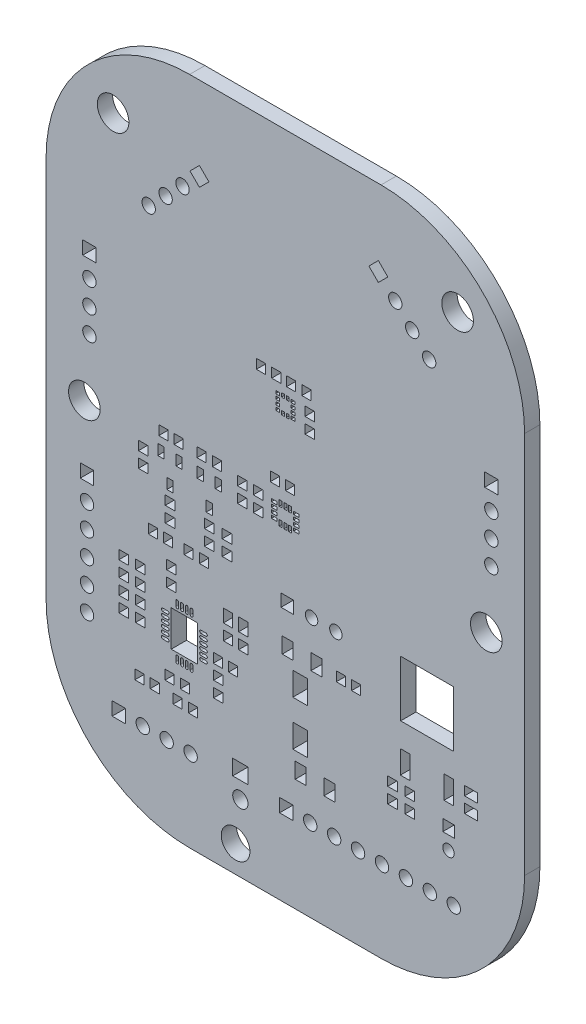
from build123d import *

# Parameters (mm, degrees)
MODEL_W            = 1.4
MODEL_H            = 1.4
MODEL_R            = 0.7
MODEL_W_2          = 0.95
MODEL_H_2          = 1
MODEL_R_2          = 1.5
MODEL_R_3          = 0.8
MODEL_W_3          = 1
MODEL_H_3          = 0.95
MODEL_W_4          = 1.6
MODEL_H_4          = 1.6
MODEL_W_5          = 0.65
MODEL_H_5          = 1.1
MODEL_W_6          = 2.75
MODEL_H_6          = 3.75
MODEL_H_7          = 1.35
MODEL_W_7          = 0.6
MODEL_H_8          = 0.3
MODEL_W_8          = 0.3
MODEL_H_9          = 0.6
MODEL_W_9          = 1.15
MODEL_H_10         = 1.65
MODEL_W_10         = 1.55
MODEL_H_11         = 2.45
MODEL_R_4          = 0.6
MODEL_W_11         = 1.2
MODEL_H_12         = 1.2
MODEL_W_12         = 1.3
MODEL_H_13         = 1.3
MODEL_R_5          = 0.65
MODEL_H_14         = 2.4
MODEL_W_13         = 5.5
MODEL_H_15         = 5.85
MODEL_W_14         = 1.35
MODEL_R_6          = 1.651
MODEL_W_15         = 0.4
MODEL_H_16         = 0.4
BOSS_EXTRU_1_DEPTH = 1.6


with BuildPart() as part:
    # Model → Boss.-Extru.1 (new body)
    with BuildSketch(Plane.XY):
        with BuildLine():
            ThreePointArc((0, 15), (4.393395, 4.393395), (15, 0))
            Line((15, 0), (35, 0))
            ThreePointArc((35, 0), (45.606605, 4.393395), (50, 15))
            Line((50, 15), (50, 55))
            ThreePointArc((50, 55), (45.606605, 65.606605), (35, 70))
            Line((35, 70), (15, 70))
            ThreePointArc((15, 70), (4.393395, 65.606605), (0, 55))
            Line((0, 55), (0, 15))
        make_face()
        with Locations((7.6, 8.575)):
            Rectangle(MODEL_W, MODEL_H, mode=Mode.SUBTRACT)
        with Locations((10.1, 8.575)):
            Circle(MODEL_R, mode=Mode.SUBTRACT)
        with Locations((4.275, 15.95)):
            Circle(MODEL_R, mode=Mode.SUBTRACT)
        with Locations((9.75, 12.85)):
            Rectangle(MODEL_W_2, MODEL_H_2, mode=Mode.SUBTRACT)
        with Locations((11.35, 12.85)):
            Rectangle(MODEL_W_2, MODEL_H_2, mode=Mode.SUBTRACT)
        with Locations((12.6, 8.575)):
            Circle(MODEL_R, mode=Mode.SUBTRACT)
        with Locations((15.1, 8.575)):
            Circle(MODEL_R, mode=Mode.SUBTRACT)
        with Locations((19.8, 2.8)):
            Circle(MODEL_R_2, mode=Mode.SUBTRACT)
        with Locations((20.3, 7.03)):
            Circle(MODEL_R_3, mode=Mode.SUBTRACT)
        with Locations((13.75, 12.65)):
            Rectangle(MODEL_W_2, MODEL_H_2, mode=Mode.SUBTRACT)
        with Locations((15.35, 12.65)):
            Rectangle(MODEL_W_2, MODEL_H_2, mode=Mode.SUBTRACT)
        with Locations((12.9, 14.4)):
            Rectangle(MODEL_W_2, MODEL_H_2, mode=Mode.SUBTRACT)
        with Locations((14.5, 14.4)):
            Rectangle(MODEL_W_2, MODEL_H_2, mode=Mode.SUBTRACT)
        with BuildLine():
            ThreePointArc((13.85, 16.15), (13.7, 16), (13.55, 16.15))
            Line((13.55, 16.15), (13.55, 16.65))
            ThreePointArc((13.55, 16.65), (13.7, 16.8), (13.85, 16.65))
            Line((13.85, 16.65), (13.85, 16.15))
        make_face(mode=Mode.SUBTRACT)
        with BuildLine():
            ThreePointArc((14.35, 16.15), (14.2, 16), (14.05, 16.15))
            Line((14.05, 16.15), (14.05, 16.65))
            ThreePointArc((14.05, 16.65), (14.2, 16.8), (14.35, 16.65))
            Line((14.35, 16.65), (14.35, 16.15))
        make_face(mode=Mode.SUBTRACT)
        with BuildLine():
            ThreePointArc((14.85, 16.15), (14.7, 16), (14.55, 16.15))
            Line((14.55, 16.15), (14.55, 16.65))
            ThreePointArc((14.55, 16.65), (14.7, 16.8), (14.85, 16.65))
            Line((14.85, 16.65), (14.85, 16.15))
        make_face(mode=Mode.SUBTRACT)
        with BuildLine():
            ThreePointArc((15.35, 16.15), (15.2, 16), (15.05, 16.15))
            Line((15.05, 16.15), (15.05, 16.65))
            ThreePointArc((15.05, 16.65), (15.2, 16.8), (15.35, 16.65))
            Line((15.35, 16.65), (15.35, 16.15))
        make_face(mode=Mode.SUBTRACT)
        with Locations((18, 15.3)):
            Rectangle(MODEL_W_3, MODEL_H_3, mode=Mode.SUBTRACT)
        with Locations((18, 16.9)):
            Rectangle(MODEL_W_3, MODEL_H_3, mode=Mode.SUBTRACT)
        with Locations((20.3, 9.57)):
            Rectangle(MODEL_W_4, MODEL_H_4, mode=Mode.SUBTRACT)
        with Locations((4.275, 18.45)):
            Circle(MODEL_R, mode=Mode.SUBTRACT)
        with Locations((4.275, 20.95)):
            Circle(MODEL_R, mode=Mode.SUBTRACT)
        with Locations((4.275, 23.45)):
            Circle(MODEL_R, mode=Mode.SUBTRACT)
        with Locations((4.275, 25.95)):
            Circle(MODEL_R, mode=Mode.SUBTRACT)
        with Locations((8.1, 18.05)):
            Rectangle(MODEL_W_3, MODEL_H_3, mode=Mode.SUBTRACT)
        with Locations((8.1, 19.65)):
            Rectangle(MODEL_W_3, MODEL_H_3, mode=Mode.SUBTRACT)
        with Locations((8.1, 21.25)):
            Rectangle(MODEL_W_3, MODEL_H_3, mode=Mode.SUBTRACT)
        with Locations((9.85, 18.05)):
            Rectangle(MODEL_W_3, MODEL_H_3, mode=Mode.SUBTRACT)
        with Locations((9.85, 19.65)):
            Rectangle(MODEL_W_3, MODEL_H_3, mode=Mode.SUBTRACT)
        with BuildLine():
            ThreePointArc((12.2, 17.5), (12.05, 17.65), (12.2, 17.8))
            Line((12.2, 17.8), (12.7, 17.8))
            ThreePointArc((12.7, 17.8), (12.85, 17.65), (12.7, 17.5))
            Line((12.7, 17.5), (12.2, 17.5))
        make_face(mode=Mode.SUBTRACT)
        with BuildLine():
            ThreePointArc((12.2, 18), (12.05, 18.15), (12.2, 18.3))
            Line((12.2, 18.3), (12.7, 18.3))
            ThreePointArc((12.7, 18.3), (12.85, 18.15), (12.7, 18))
            Line((12.7, 18), (12.2, 18))
        make_face(mode=Mode.SUBTRACT)
        with BuildLine():
            ThreePointArc((12.2, 18.5), (12.05, 18.65), (12.2, 18.8))
            Line((12.2, 18.8), (12.7, 18.8))
            ThreePointArc((12.7, 18.8), (12.85, 18.65), (12.7, 18.5))
            Line((12.7, 18.5), (12.2, 18.5))
        make_face(mode=Mode.SUBTRACT)
        with BuildLine():
            ThreePointArc((12.2, 19), (12.05, 19.15), (12.2, 19.3))
            Line((12.2, 19.3), (12.7, 19.3))
            ThreePointArc((12.7, 19.3), (12.85, 19.15), (12.7, 19))
            Line((12.7, 19), (12.2, 19))
        make_face(mode=Mode.SUBTRACT)
        with BuildLine():
            ThreePointArc((12.2, 19.5), (12.05, 19.65), (12.2, 19.8))
            Line((12.2, 19.8), (12.7, 19.8))
            ThreePointArc((12.7, 19.8), (12.85, 19.65), (12.7, 19.5))
            Line((12.7, 19.5), (12.2, 19.5))
        make_face(mode=Mode.SUBTRACT)
        with Locations((9.85, 21.25)):
            Rectangle(MODEL_W_3, MODEL_H_3, mode=Mode.SUBTRACT)
        with BuildLine():
            ThreePointArc((12.2, 20), (12.05, 20.15), (12.2, 20.3))
            Line((12.2, 20.3), (12.7, 20.3))
            ThreePointArc((12.7, 20.3), (12.85, 20.15), (12.7, 20))
            Line((12.7, 20), (12.2, 20))
        make_face(mode=Mode.SUBTRACT)
        with Locations((8.1, 22.85)):
            Rectangle(MODEL_W_3, MODEL_H_3, mode=Mode.SUBTRACT)
        with Locations((9.85, 22.85)):
            Rectangle(MODEL_W_3, MODEL_H_3, mode=Mode.SUBTRACT)
        with Locations((4.275, 28.45)):
            Rectangle(MODEL_W, MODEL_H, mode=Mode.SUBTRACT)
        with Locations((11.15, 26.75)):
            Rectangle(MODEL_W_2, MODEL_H_2, mode=Mode.SUBTRACT)
        with Locations((10.15, 32.15)):
            Rectangle(MODEL_W_3, MODEL_H_3, mode=Mode.SUBTRACT)
        with Locations((10.15, 33.75)):
            Rectangle(MODEL_W_3, MODEL_H_3, mode=Mode.SUBTRACT)
        with Locations((12, 34.4)):
            Rectangle(MODEL_W_5, MODEL_H_5, mode=Mode.SUBTRACT)
        with Locations((14.45, 18.9)):
            Rectangle(MODEL_W_6, MODEL_H_6, mode=Mode.SUBTRACT)
        with BuildLine():
            ThreePointArc((13.85, 21.15), (13.7, 21), (13.55, 21.15))
            Line((13.55, 21.15), (13.55, 21.65))
            ThreePointArc((13.55, 21.65), (13.7, 21.8), (13.85, 21.65))
            Line((13.85, 21.65), (13.85, 21.15))
        make_face(mode=Mode.SUBTRACT)
        with BuildLine():
            ThreePointArc((14.35, 21.15), (14.2, 21), (14.05, 21.15))
            Line((14.05, 21.15), (14.05, 21.65))
            ThreePointArc((14.05, 21.65), (14.2, 21.8), (14.35, 21.65))
            Line((14.35, 21.65), (14.35, 21.15))
        make_face(mode=Mode.SUBTRACT)
        with BuildLine():
            ThreePointArc((14.85, 21.15), (14.7, 21), (14.55, 21.15))
            Line((14.55, 21.15), (14.55, 21.65))
            ThreePointArc((14.55, 21.65), (14.7, 21.8), (14.85, 21.65))
            Line((14.85, 21.65), (14.85, 21.15))
        make_face(mode=Mode.SUBTRACT)
        with BuildLine():
            ThreePointArc((15.35, 21.15), (15.2, 21), (15.05, 21.15))
            Line((15.05, 21.15), (15.05, 21.65))
            ThreePointArc((15.05, 21.65), (15.2, 21.8), (15.35, 21.65))
            Line((15.35, 21.65), (15.35, 21.15))
        make_face(mode=Mode.SUBTRACT)
        with BuildLine():
            ThreePointArc((16.2, 17.5), (16.05, 17.65), (16.2, 17.8))
            Line((16.2, 17.8), (16.7, 17.8))
            ThreePointArc((16.7, 17.8), (16.85, 17.65), (16.7, 17.5))
            Line((16.7, 17.5), (16.2, 17.5))
        make_face(mode=Mode.SUBTRACT)
        with BuildLine():
            ThreePointArc((16.2, 18), (16.05, 18.15), (16.2, 18.3))
            Line((16.2, 18.3), (16.7, 18.3))
            ThreePointArc((16.7, 18.3), (16.85, 18.15), (16.7, 18))
            Line((16.7, 18), (16.2, 18))
        make_face(mode=Mode.SUBTRACT)
        with BuildLine():
            ThreePointArc((16.2, 18.5), (16.05, 18.65), (16.2, 18.8))
            Line((16.2, 18.8), (16.7, 18.8))
            ThreePointArc((16.7, 18.8), (16.85, 18.65), (16.7, 18.5))
            Line((16.7, 18.5), (16.2, 18.5))
        make_face(mode=Mode.SUBTRACT)
        with BuildLine():
            ThreePointArc((16.2, 19), (16.05, 19.15), (16.2, 19.3))
            Line((16.2, 19.3), (16.7, 19.3))
            ThreePointArc((16.7, 19.3), (16.85, 19.15), (16.7, 19))
            Line((16.7, 19), (16.2, 19))
        make_face(mode=Mode.SUBTRACT)
        with BuildLine():
            ThreePointArc((16.2, 19.5), (16.05, 19.65), (16.2, 19.8))
            Line((16.2, 19.8), (16.7, 19.8))
            ThreePointArc((16.7, 19.8), (16.85, 19.65), (16.7, 19.5))
            Line((16.7, 19.5), (16.2, 19.5))
        make_face(mode=Mode.SUBTRACT)
        with Locations((17.95, 18.45)):
            Rectangle(MODEL_W_2, MODEL_H_2, mode=Mode.SUBTRACT)
        with BuildLine():
            ThreePointArc((16.2, 20), (16.05, 20.15), (16.2, 20.3))
            Line((16.2, 20.3), (16.7, 20.3))
            ThreePointArc((16.7, 20.3), (16.85, 20.15), (16.7, 20))
            Line((16.7, 20), (16.2, 20))
        make_face(mode=Mode.SUBTRACT)
        with Locations((13.1, 22.85)):
            Rectangle(MODEL_W_3, MODEL_H_3, mode=Mode.SUBTRACT)
        with Locations((13.1, 24.45)):
            Rectangle(MODEL_W_3, MODEL_H_3, mode=Mode.SUBTRACT)
        with Locations((19.55, 18.45)):
            Rectangle(MODEL_W_2, MODEL_H_2, mode=Mode.SUBTRACT)
        with Locations((19, 21)):
            Rectangle(MODEL_W_2, MODEL_H_2, mode=Mode.SUBTRACT)
        with Locations((20.6, 21)):
            Rectangle(MODEL_W_2, MODEL_H_2, mode=Mode.SUBTRACT)
        with Locations((19, 22.8)):
            Rectangle(MODEL_W_2, MODEL_H_7, mode=Mode.SUBTRACT)
        with Locations((20.6, 22.8)):
            Rectangle(MODEL_W_2, MODEL_H_7, mode=Mode.SUBTRACT)
        with Locations((12.75, 26.75)):
            Rectangle(MODEL_W_2, MODEL_H_2, mode=Mode.SUBTRACT)
        with Locations((14.9, 26.75)):
            Rectangle(MODEL_W_2, MODEL_H_2, mode=Mode.SUBTRACT)
        with Locations((12.95, 28.6)):
            Rectangle(MODEL_W_3, MODEL_H_3, mode=Mode.SUBTRACT)
        with Locations((12.95, 30.2)):
            Rectangle(MODEL_W_3, MODEL_H_3, mode=Mode.SUBTRACT)
        with Locations((16.5, 26.75)):
            Rectangle(MODEL_W_2, MODEL_H_2, mode=Mode.SUBTRACT)
        with Locations((17.05, 28.55)):
            Rectangle(MODEL_W_3, MODEL_H_3, mode=Mode.SUBTRACT)
        with Locations((17.05, 30.15)):
            Rectangle(MODEL_W_3, MODEL_H_3, mode=Mode.SUBTRACT)
        with Locations((12.95, 31.8)):
            Rectangle(MODEL_W_5, MODEL_H_5, mode=Mode.SUBTRACT)
        with Locations((13.9, 34.4)):
            Rectangle(MODEL_W_5, MODEL_H_5, mode=Mode.SUBTRACT)
        with Locations((17.05, 31.8)):
            Rectangle(MODEL_W_5, MODEL_H_5, mode=Mode.SUBTRACT)
        with Locations((16.1, 34.4)):
            Rectangle(MODEL_W_5, MODEL_H_5, mode=Mode.SUBTRACT)
        with Locations((18, 34.4)):
            Rectangle(MODEL_W_5, MODEL_H_5, mode=Mode.SUBTRACT)
        with Locations((18.9, 28.55)):
            Rectangle(MODEL_W_3, MODEL_H_3, mode=Mode.SUBTRACT)
        with Locations((18.9, 30.15)):
            Rectangle(MODEL_W_3, MODEL_H_3, mode=Mode.SUBTRACT)
        with Locations((20.5, 34.15)):
            Rectangle(MODEL_W_3, MODEL_H_3, mode=Mode.SUBTRACT)
        with Locations((22.15, 34.15)):
            Rectangle(MODEL_W_3, MODEL_H_3, mode=Mode.SUBTRACT)
        with Locations((23.85, 34.25)):
            Rectangle(MODEL_W_7, MODEL_H_8, mode=Mode.SUBTRACT)
        with Locations((23.85, 34.75)):
            Rectangle(MODEL_W_7, MODEL_H_8, mode=Mode.SUBTRACT)
        with Locations((24.5, 34.1)):
            Rectangle(MODEL_W_8, MODEL_H_9, mode=Mode.SUBTRACT)
        with Locations((25.1, 8.575)):
            Rectangle(MODEL_W, MODEL_H, mode=Mode.SUBTRACT)
        with Locations((27.6, 8.575)):
            Circle(MODEL_R, mode=Mode.SUBTRACT)
        with Locations((30.1, 8.575)):
            Circle(MODEL_R, mode=Mode.SUBTRACT)
        with Locations((32.6, 8.575)):
            Circle(MODEL_R, mode=Mode.SUBTRACT)
        with Locations((35.1, 8.575)):
            Circle(MODEL_R, mode=Mode.SUBTRACT)
        with Locations((26.6, 12.55)):
            Rectangle(MODEL_W_9, MODEL_H_10, mode=Mode.SUBTRACT)
        with Locations((29.6, 12.55)):
            Rectangle(MODEL_W_9, MODEL_H_10, mode=Mode.SUBTRACT)
        with Locations((26.55, 15.55)):
            Rectangle(MODEL_W_10, MODEL_H_11, mode=Mode.SUBTRACT)
        with Locations((36.2, 14.8)):
            Rectangle(MODEL_W_3, MODEL_H_3, mode=Mode.SUBTRACT)
        with Locations((36.2, 16.4)):
            Rectangle(MODEL_W_3, MODEL_H_3, mode=Mode.SUBTRACT)
        with Locations((37.6, 8.575)):
            Circle(MODEL_R, mode=Mode.SUBTRACT)
        with Locations((40.1, 8.575)):
            Circle(MODEL_R, mode=Mode.SUBTRACT)
        with Locations((42.6, 8.575)):
            Circle(MODEL_R, mode=Mode.SUBTRACT)
        with Locations((38, 14.8)):
            Rectangle(MODEL_W_3, MODEL_H_3, mode=Mode.SUBTRACT)
        with Locations((38, 16.4)):
            Rectangle(MODEL_W_3, MODEL_H_3, mode=Mode.SUBTRACT)
        with Locations((42.05, 13.3)):
            Circle(MODEL_R_4, mode=Mode.SUBTRACT)
        with Locations((42.05, 15.3)):
            Rectangle(MODEL_W_11, MODEL_H_12, mode=Mode.SUBTRACT)
        with Locations((26.55, 20.25)):
            Rectangle(MODEL_W_10, MODEL_H_11, mode=Mode.SUBTRACT)
        with Locations((25.25, 23.2)):
            Rectangle(MODEL_W_9, MODEL_H_10, mode=Mode.SUBTRACT)
        with Locations((28.25, 23.2)):
            Rectangle(MODEL_W_9, MODEL_H_10, mode=Mode.SUBTRACT)
        with Locations((30.8, 23.2)):
            Rectangle(MODEL_W_2, MODEL_H_2, mode=Mode.SUBTRACT)
        with Locations((32.4, 23.2)):
            Rectangle(MODEL_W_2, MODEL_H_2, mode=Mode.SUBTRACT)
        with Locations((25.2, 27.2)):
            Rectangle(MODEL_W_12, MODEL_H_13, mode=Mode.SUBTRACT)
        with Locations((27.74, 27.2)):
            Circle(MODEL_R_5, mode=Mode.SUBTRACT)
        with Locations((30.28, 27.2)):
            Circle(MODEL_R_5, mode=Mode.SUBTRACT)
        with Locations((25, 34.1)):
            Rectangle(MODEL_W_8, MODEL_H_9, mode=Mode.SUBTRACT)
        with Locations((25.5, 34.1)):
            Rectangle(MODEL_W_8, MODEL_H_9, mode=Mode.SUBTRACT)
        with Locations((26.15, 34.25)):
            Rectangle(MODEL_W_7, MODEL_H_8, mode=Mode.SUBTRACT)
        with Locations((26.15, 34.75)):
            Rectangle(MODEL_W_7, MODEL_H_8, mode=Mode.SUBTRACT)
        with Locations((37.52, 18.8)):
            Rectangle(MODEL_W_3, MODEL_H_14, mode=Mode.SUBTRACT)
        with Locations((42.08, 18.8)):
            Rectangle(MODEL_W_3, MODEL_H_14, mode=Mode.SUBTRACT)
        with Locations((39.8, 25.45)):
            Rectangle(MODEL_W_13, MODEL_H_15, mode=Mode.SUBTRACT)
        with Locations((44.4, 17.95)):
            Rectangle(MODEL_W_14, MODEL_H_3, mode=Mode.SUBTRACT)
        with Locations((44.4, 19.55)):
            Rectangle(MODEL_W_14, MODEL_H_3, mode=Mode.SUBTRACT)
        with Locations((4, 35)):
            Circle(MODEL_R_6, mode=Mode.SUBTRACT)
        with Locations((4.525, 41.25)):
            Circle(MODEL_R, mode=Mode.SUBTRACT)
        with Locations((4.525, 43.75)):
            Circle(MODEL_R, mode=Mode.SUBTRACT)
        with Locations((12.25, 36.2)):
            Rectangle(MODEL_W_2, MODEL_H_2, mode=Mode.SUBTRACT)
        with Locations((4.525, 46.25)):
            Circle(MODEL_R, mode=Mode.SUBTRACT)
        with Locations((4.525, 48.75)):
            Rectangle(MODEL_W, MODEL_H, mode=Mode.SUBTRACT)
        with Locations((13.85, 36.2)):
            Rectangle(MODEL_W_2, MODEL_H_2, mode=Mode.SUBTRACT)
        with Locations((16.25, 36.2)):
            Rectangle(MODEL_W_2, MODEL_H_2, mode=Mode.SUBTRACT)
        with Locations((17.85, 36.2)):
            Rectangle(MODEL_W_2, MODEL_H_2, mode=Mode.SUBTRACT)
        with Locations((20.5, 35.75)):
            Rectangle(MODEL_W_3, MODEL_H_3, mode=Mode.SUBTRACT)
        with Locations((22.15, 35.75)):
            Rectangle(MODEL_W_3, MODEL_H_3, mode=Mode.SUBTRACT)
        with Locations((23.85, 35.25)):
            Rectangle(MODEL_W_7, MODEL_H_8, mode=Mode.SUBTRACT)
        with Locations((23.85, 35.75)):
            Rectangle(MODEL_W_7, MODEL_H_8, mode=Mode.SUBTRACT)
        with Locations((24.5, 35.9)):
            Rectangle(MODEL_W_8, MODEL_H_9, mode=Mode.SUBTRACT)
        with Locations((23.9, 37.85)):
            Rectangle(MODEL_W_2, MODEL_H_2, mode=Mode.SUBTRACT)
        with Locations((24.2, 44.25)):
            Rectangle(MODEL_W_15, MODEL_H_8, mode=Mode.SUBTRACT)
        with Locations((24.2, 44.75)):
            Rectangle(MODEL_W_15, MODEL_H_8, mode=Mode.SUBTRACT)
        with Locations((24.75, 44.2)):
            Rectangle(MODEL_W_8, MODEL_H_16, mode=Mode.SUBTRACT)
        with Locations((24.2, 45.25)):
            Rectangle(MODEL_W_15, MODEL_H_8, mode=Mode.SUBTRACT)
        with Locations((24.2, 45.75)):
            Rectangle(MODEL_W_15, MODEL_H_8, mode=Mode.SUBTRACT)
        with Locations((24.75, 45.8)):
            Rectangle(MODEL_W_8, MODEL_H_16, mode=Mode.SUBTRACT)
        with Locations((22.45, 47.3)):
            Rectangle(MODEL_W_2, MODEL_H_2, mode=Mode.SUBTRACT)
        with Locations((24.05, 47.3)):
            Rectangle(MODEL_W_2, MODEL_H_2, mode=Mode.SUBTRACT)
        with Locations((10.7195, 55.9771)):
            Circle(MODEL_R, mode=Mode.SUBTRACT)
        with Locations((12.4873, 57.7449)):
            Circle(MODEL_R, mode=Mode.SUBTRACT)
        with Locations((7, 62.5)):
            Circle(MODEL_R_6, mode=Mode.SUBTRACT)
        with Locations((14.255, 59.5126)):
            Circle(MODEL_R, mode=Mode.SUBTRACT)
        Polygon((15.032851, 61.2804), (16.0228, 62.270349), (17.012749, 61.2804), (16.0228, 60.290451), align=None, mode=Mode.SUBTRACT)
        with Locations((25, 35.9)):
            Rectangle(MODEL_W_8, MODEL_H_9, mode=Mode.SUBTRACT)
        with Locations((25.5, 35.9)):
            Rectangle(MODEL_W_8, MODEL_H_9, mode=Mode.SUBTRACT)
        with Locations((26.15, 35.25)):
            Rectangle(MODEL_W_7, MODEL_H_8, mode=Mode.SUBTRACT)
        with Locations((26.15, 35.75)):
            Rectangle(MODEL_W_7, MODEL_H_8, mode=Mode.SUBTRACT)
        with Locations((25.5, 37.85)):
            Rectangle(MODEL_W_2, MODEL_H_2, mode=Mode.SUBTRACT)
        with Locations((25.25, 44.2)):
            Rectangle(MODEL_W_8, MODEL_H_16, mode=Mode.SUBTRACT)
        with Locations((25.8, 44.25)):
            Rectangle(MODEL_W_15, MODEL_H_8, mode=Mode.SUBTRACT)
        with Locations((25.8, 44.75)):
            Rectangle(MODEL_W_15, MODEL_H_8, mode=Mode.SUBTRACT)
        with Locations((25.25, 45.8)):
            Rectangle(MODEL_W_8, MODEL_H_16, mode=Mode.SUBTRACT)
        with Locations((25.8, 45.25)):
            Rectangle(MODEL_W_15, MODEL_H_8, mode=Mode.SUBTRACT)
        with Locations((25.8, 45.75)):
            Rectangle(MODEL_W_15, MODEL_H_8, mode=Mode.SUBTRACT)
        with Locations((27.55, 43.95)):
            Rectangle(MODEL_W_3, MODEL_H_3, mode=Mode.SUBTRACT)
        with Locations((27.55, 45.55)):
            Rectangle(MODEL_W_3, MODEL_H_3, mode=Mode.SUBTRACT)
        with Locations((25.6, 47.3)):
            Rectangle(MODEL_W_2, MODEL_H_2, mode=Mode.SUBTRACT)
        with Locations((27.2, 47.3)):
            Rectangle(MODEL_W_2, MODEL_H_2, mode=Mode.SUBTRACT)
        with Locations((46, 35)):
            Circle(MODEL_R_6, mode=Mode.SUBTRACT)
        with Locations((46.525, 41.25)):
            Circle(MODEL_R, mode=Mode.SUBTRACT)
        with Locations((46.525, 43.75)):
            Circle(MODEL_R, mode=Mode.SUBTRACT)
        with Locations((46.525, 46.25)):
            Circle(MODEL_R, mode=Mode.SUBTRACT)
        with Locations((46.525, 48.75)):
            Rectangle(MODEL_W, MODEL_H, mode=Mode.SUBTRACT)
        with Locations((36.4873, 60.255)):
            Circle(MODEL_R, mode=Mode.SUBTRACT)
        Polygon((34.7195, 61.032851), (33.729551, 62.0228), (34.7195, 63.012749), (35.709449, 62.0228), align=None, mode=Mode.SUBTRACT)
        with Locations((40.0228, 56.7195)):
            Circle(MODEL_R, mode=Mode.SUBTRACT)
        with Locations((38.255, 58.4873)):
            Circle(MODEL_R, mode=Mode.SUBTRACT)
        with Locations((43, 62.5)):
            Circle(MODEL_R_6, mode=Mode.SUBTRACT)
    extrude(amount=BOSS_EXTRU_1_DEPTH)


solid = part.part
